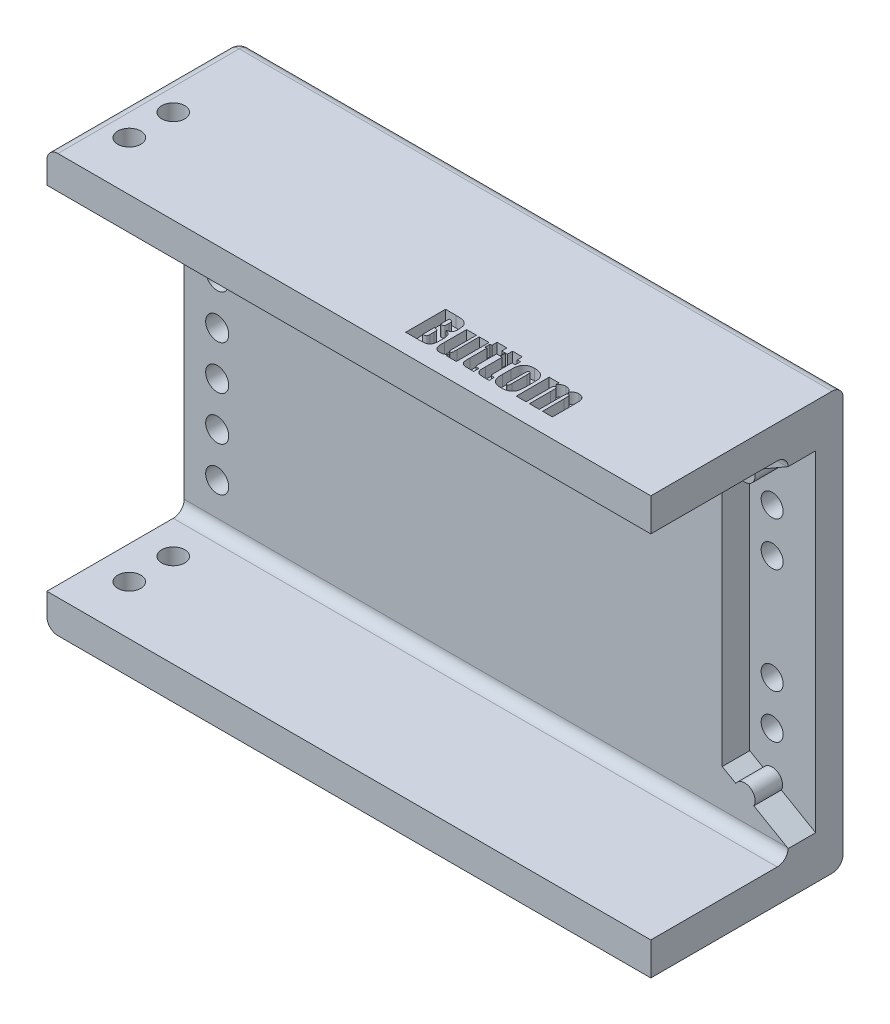
from build123d import *

# Parameters (mm, degrees)
SKETCH_2_W               = 109.92
SKETCH_2_H               = 76
EXTRUDE_1_DEPTH          = 10
CUT_EXTRUDE_1_DEPTH      = 5
SKETCH_4_R               = 2
CUT_EXTRUDE_2_DEPTH      = 92.808295873
SKETCH_5_W               = 109.92
SKETCH_5_H               = 6
EXTRUDE_2_DEPTH          = 25
CUT_EXTRUDE_3_DEPTH      = 104.340627651
CUT_EXTRUDE_3_DEPTH_BACK = 104.340627651
SKETCH_7_R               = 2.1
SKETCH_9_R               = 2.1
CUT_EXTRUDE_4_DEPTH      = 96.019804204
CUT_EXTRUDE_5_DEPTH      = 5
FILLET_1_R               = 2
CUT_EXTRUDE_6_DEPTH      = 2


with BuildPart() as part:
    # 草圖2 → 填料-伸長1 (new body)
    with BuildSketch(Plane.XY):
        with Locations((12.52544527, 24.044160626)):
            Rectangle(SKETCH_2_W, SKETCH_2_H)
    extrude(amount=EXTRUDE_1_DEPTH)

    # 草圖3 → 除料-伸長1 (cut)
    with BuildSketch(Plane.XY.offset(10)):
        with BuildLine():
            Line((67.48544527, -6.055839374), (67.48544527, 54.144160626))
            Line((67.48544527, 54.144160626), (61.24181631, 50.538464901))
            ThreePointArc((61.24181631, 50.538464901), (61.408690367, 50.105080914), (61.46544527, 49.644160626))
            ThreePointArc((61.46544527, 49.644160626), (60.088104264, 47.81746208), (57.95299519, 48.639170705))
            Line((57.95299519, 48.639170705), (55.48544527, 47.214160626))
            Line((55.48544527, 47.214160626), (55.48544527, 0.874160626))
            Line((55.48544527, 0.874160626), (57.95299519, -0.550849453))
            ThreePointArc((57.95299519, -0.550849453), (60.088104264, 0.270859171), (61.46544527, -1.555839374))
            ThreePointArc((61.46544527, -1.555839374), (61.408690367, -2.016759663), (61.24181631, -2.45014365))
            Line((61.24181631, -2.45014365), (67.48544527, -6.055839374))
        make_face()
    extrude(amount=-CUT_EXTRUDE_1_DEPTH, mode=Mode.SUBTRACT)

    # 草圖4 → 除料-伸長2 (cut, through all)
    with BuildSketch(Plane.XY.offset(5)):
        with Locations((59.56544527, 41.644160626)):
            Circle(SKETCH_4_R)
        with Locations((59.56544527, 33.644160626)):
            Circle(SKETCH_4_R)
        with Locations((59.56544527, 6.444160626)):
            Circle(SKETCH_4_R)
        with Locations((59.56544527, 14.444160626)):
            Circle(SKETCH_4_R)
    extrude(amount=-CUT_EXTRUDE_2_DEPTH, mode=Mode.SUBTRACT)

    # 草圖5 → 填料-伸長2 (add)
    with BuildSketch(Plane.XY.offset(10)):
        with Locations((12.52544527, -10.955839374)):
            Rectangle(SKETCH_5_W, SKETCH_5_H)
        with Locations((12.52544527, 59.044160626)):
            Rectangle(SKETCH_5_W, SKETCH_5_H)
    extrude(amount=EXTRUDE_2_DEPTH)

    # 草圖7 → 除料-伸長3 (cut, two sides: drawn at the far end of the back side and taken through both)
    with BuildSketch(Plane(origin=(0, -7.955839374, 0), x_dir=(1, 0, 0), z_dir=(0, 1, 0)).offset(-CUT_EXTRUDE_3_DEPTH_BACK)):
        with Locations(Location((-36.43455473, -18, 0), (0, 0, 270))):
            Circle(SKETCH_7_R)
        with Locations(Location((-36.43455473, -26, 0), (0, 0, 270))):
            Circle(SKETCH_7_R)
    extrude(amount=CUT_EXTRUDE_3_DEPTH + CUT_EXTRUDE_3_DEPTH_BACK, mode=Mode.SUBTRACT)

    # 草圖9 → 除料-伸長4 (cut, through all)
    with BuildSketch(Plane.XY.offset(10)):
        with Locations((-36.43455473, 0.044160626)):
            Circle(SKETCH_9_R)
        with Locations((-36.43455473, 8.044160626)):
            Circle(SKETCH_9_R)
        with Locations((-36.43455473, 16.044160626)):
            Circle(SKETCH_9_R)
        with Locations((-36.43455473, 24.044160626)):
            Circle(SKETCH_9_R)
        with Locations((-36.43455473, 32.044160626)):
            Circle(SKETCH_9_R)
        with Locations((-36.43455473, 40.044160626)):
            Circle(SKETCH_9_R)
        with Locations((-36.43455473, 48.044160626)):
            Circle(SKETCH_9_R)
    extrude(amount=-CUT_EXTRUDE_4_DEPTH, mode=Mode.SUBTRACT)

    # 草圖10 → 除料-伸長5 (cut)
    with BuildSketch(Plane(origin=(0, 0, 0), x_dir=(-1, 0, 0), z_dir=(0, 0, -1))):
        with BuildLine():
            Line((32.43455473, 0.044160626), (32.43455473, 48.044160626))
            ThreePointArc((32.43455473, 48.044160626), (36.43455473, 52.044160626), (40.43455473, 48.044160626))
            Line((40.43455473, 48.044160626), (40.43455473, 0.044160626))
            ThreePointArc((40.43455473, 0.044160626), (36.43455473, -3.955839374), (32.43455473, 0.044160626))
        make_face()
    extrude(amount=-CUT_EXTRUDE_5_DEPTH, mode=Mode.SUBTRACT)

    # 圓角1
    fillet_1_edges = [part.edges().sort_by_distance(p)[0] for p in [
        (12.52544527, 56.044160626, 10),
        (12.52544527, -7.955839374, 10),
        (-42.43455473, 62.044160626, 17.5),
        (-42.43455473, -13.955839374, 17.5),
        (-42.43455473, 24.044160626, 0),
        (12.52544527, -13.955839374, 0),
        (12.52544527, 62.044160626, 0),
    ]]
    fillet(fillet_1_edges, radius=FILLET_1_R - 0.0001)  # a hair under: the kernel refuses the full size

    # 草圖11 → 除料-伸長6 (cut)
    # profile 1 of 6: a face of its own
    with BuildSketch(Plane(origin=(0, 62.044160626, 62.044160626), x_dir=(-1, 0, 0), z_dir=(0, -1, 0))):
        with BuildLine():
            Line((-19.393974729, 37.772018325), (-21.317327272, 37.772018325))
            add(Edge.make_bspline(
                [(-21.317327272, 37.772018325), (-21.391082107, 37.771291446), (-21.533722337, 37.769885678), (-21.740849556, 37.76520881), (-21.934255834, 37.754908999), (-22.113670498, 37.738186673), (-22.279722046, 37.720668444), (-22.431714413, 37.696358362), (-22.570117507, 37.668818928), (-22.696402043, 37.63696519), (-22.812663003, 37.597684206), (-22.922409633, 37.551530111), (-23.025791597, 37.494942957), (-23.123050721, 37.429259749), (-23.215753475, 37.355746427), (-23.302183201, 37.273108102), (-23.382687668, 37.181550935), (-23.458078877, 37.081008177), (-23.527295896, 36.96808395), (-23.58559776, 36.838989186), (-23.634175607, 36.694065718), (-23.676033737, 36.533944129), (-23.705262316, 36.35759485), (-23.727817023, 36.165906343), (-23.743153064, 35.958207901), (-23.744047136, 35.814039634), (-23.744510211, 35.739369241)],
                knots=[0, 0, 0, 0, 1.41969272, 2.745654521, 3.987543411, 5.14658096, 6.21373459, 7.200711201, 8.108042895, 8.929411192, 9.70554979, 10.467999137, 11.218070552, 11.969943563, 12.724535131, 13.49271798, 14.268243868, 15.068689038, 15.909069341, 16.81215954, 17.78844528, 18.848344307, 19.994182421, 21.225693104, 22.563077773, 24, 24, 24, 24], degree=3))
            add(Edge.make_bspline(
                [(-23.744510211, 35.739369241), (-23.744298774, 35.689138971), (-23.743892194, 35.592549762), (-23.732485177, 35.453801347), (-23.716762707, 35.327017964), (-23.696380206, 35.211241149), (-23.667014075, 35.107954587), (-23.632431342, 35.01573961), (-23.591487065, 34.935219727), (-23.542309848, 34.865005878), (-23.48299394, 34.80356881), (-23.412357109, 34.7473094), (-23.330331362, 34.694315337), (-23.234873623, 34.646764175), (-23.128898108, 34.599161223), (-23.008577967, 34.559706048), (-22.877426024, 34.519790218), (-22.784991784, 34.498749276), (-22.73684942, 34.487790559)],
                knots=[0, 0, 0, 0, 1.327920484, 2.553495959, 3.678584238, 4.706394844, 5.65862556, 6.514014339, 7.30753027, 8.04101456, 8.772331145, 9.55771541, 10.424646689, 11.349518022, 12.375513716, 13.493956262, 14.694781581, 16, 16, 16, 16], degree=3))
            add(Edge.make_bspline(
                [(-22.73684942, 34.487790559), (-22.788142406, 34.475177999), (-22.887202813, 34.450819789), (-23.027910977, 34.40377848), (-23.155715527, 34.350692097), (-23.271362248, 34.292462231), (-23.373598562, 34.226681038), (-23.463058606, 34.15485586), (-23.540469343, 34.077241937), (-23.603846134, 33.991255393), (-23.65801928, 33.89723782), (-23.704838385, 33.792866113), (-23.742647543, 33.676424308), (-23.774858633, 33.548656777), (-23.799813466, 33.409716328), (-23.816714734, 33.258765122), (-23.827405595, 33.096856908), (-23.828995425, 32.984758548), (-23.829814829, 32.92698264)],
                knots=[0, 0, 0, 0, 1.193541528, 2.305046348, 3.349469872, 4.319601517, 5.227715379, 6.091898615, 6.908561027, 7.697906746, 8.498857849, 9.357421084, 10.27838222, 11.262396817, 12.333987418, 13.466302598, 14.694123014, 16, 16, 16, 16], degree=3))
            Line((-23.829814829, 32.92698264), (-23.829814829, 32.245878586))
            add(Edge.make_bspline(
                [(-23.829814829, 32.245878586), (-23.829339253, 32.185889265), (-23.828419353, 32.069852617), (-23.820365532, 31.901796163), (-23.807318793, 31.745701444), (-23.788881916, 31.601558613), (-23.765156022, 31.469346172), (-23.73607865, 31.349067436), (-23.701742139, 31.240625298), (-23.649454041, 31.114539958), (-23.568964697, 30.975424791), (-23.443160051, 30.836292146), (-23.292688661, 30.724961573), (-23.144742801, 30.657171827), (-23.006295146, 30.617948586), (-22.876632887, 30.591622952), (-22.723114246, 30.569465091), (-22.544641712, 30.553199342), (-22.342926541, 30.538424074), (-22.116274793, 30.527628023), (-21.865603419, 30.523292117), (-21.690091164, 30.521868326), (-21.598565933, 30.521125855)],
                knots=[0, 0, 0, 0, 1.057231904, 2.044991421, 2.964498811, 3.817267374, 4.605195048, 5.330688826, 5.996832831, 6.607610909, 7.734358025, 8.809960447, 9.890596186, 11.011751471, 11.656044114, 12.423911222, 13.341950389, 14.388368498, 15.581715371, 16.906549738, 18.386843414, 20, 20, 20, 20], degree=3))
            Line((-21.598565933, 30.521125855), (-19.393974729, 30.521125855))
            Line((-19.393974729, 30.521125855), (-19.393974729, 37.772018325))
        make_face()
        with BuildLine():
            Line((-21.27067631, 36.577753683), (-21.27067631, 34.956965954))
            add(Edge.make_bspline(
                [(-21.27067631, 34.956965954), (-21.310216963, 34.957939648), (-21.379519977, 34.959646243), (-21.448837656, 34.96056853), (-21.478606314, 34.960964608)],
                knots=[0, 0, 0, 0, 1.141094767, 2, 2, 2, 2], degree=3))
            add(Edge.make_bspline(
                [(-21.478606314, 34.960964608), (-21.525448616, 34.961805921), (-21.610316423, 34.963330193), (-21.724073084, 34.990048835), (-21.812813549, 35.031243879), (-21.866209127, 35.086499938), (-21.891914013, 35.144928952), (-21.908737993, 35.203612966), (-21.921023439, 35.278396147), (-21.933203569, 35.368567964), (-21.942047371, 35.475340107), (-21.948501347, 35.597570968), (-21.952471209, 35.735789372), (-21.952890956, 35.833112759), (-21.953113248, 35.884653667)],
                knots=[0, 0, 0, 0, 1.37184632, 2.485479705, 3.407178563, 4.210095408, 4.671083265, 5.269542147, 5.998719677, 6.893441603, 7.940942625, 9.142754617, 10.486848569, 12, 12, 12, 12], degree=3))
            add(Edge.make_bspline(
                [(-21.953113248, 35.884653667), (-21.952645566, 35.937569417), (-21.951783039, 36.035159772), (-21.938490737, 36.168391672), (-21.919238855, 36.276885359), (-21.887987814, 36.361327537), (-21.849618047, 36.426225497), (-21.806297961, 36.476807237), (-21.757890301, 36.515649465), (-21.699516261, 36.541043569), (-21.626303772, 36.556394632), (-21.531323425, 36.567535946), (-21.409846863, 36.57508598), (-21.32000483, 36.576808125), (-21.27067631, 36.577753683)],
                knots=[0, 0, 0, 0, 1.612962093, 2.974720053, 4.080187332, 4.963539136, 5.704836737, 6.3676796, 6.985654596, 7.580003915, 8.289925548, 9.259673838, 10.495400982, 12, 12, 12, 12], degree=3))
        make_face(mode=Mode.SUBTRACT)
        with BuildLine():
            Line((-21.27067631, 33.848005929), (-21.27067631, 31.715390497))
            add(Edge.make_bspline(
                [(-21.27067631, 31.715390497), (-21.305784755, 31.71696004), (-21.372518315, 31.719943402), (-21.467795462, 31.727427119), (-21.552679761, 31.739626624), (-21.628175384, 31.753615446), (-21.693584402, 31.772436202), (-21.749599849, 31.793241373), (-21.796129167, 31.816734202), (-21.833085692, 31.846126078), (-21.862201865, 31.883374845), (-21.887805801, 31.928896027), (-21.906867241, 31.986556205), (-21.924034339, 32.053753673), (-21.93720521, 32.131782701), (-21.945793111, 32.22041393), (-21.953216897, 32.319511963), (-21.953148786, 32.389369344), (-21.953113248, 32.425818013)],
                knots=[0, 0, 0, 0, 1.419095288, 2.697393149, 3.856866357, 4.880718774, 5.794967692, 6.601281627, 7.291456808, 7.891047755, 8.490638702, 9.189387817, 9.989490768, 10.933700266, 11.989587216, 13.180284702, 14.528790147, 16, 16, 16, 16], degree=3))
            Line((-21.953113248, 32.425818013), (-21.953113248, 33.137578413))
            add(Edge.make_bspline(
                [(-21.953113248, 33.137578413), (-21.952951506, 33.17623285), (-21.952644571, 33.249586235), (-21.947873937, 33.353739918), (-21.937321801, 33.445958227), (-21.929070754, 33.526695502), (-21.91183169, 33.59449254), (-21.894446921, 33.651039125), (-21.871830627, 33.695568944), (-21.845493961, 33.730737403), (-21.809593923, 33.75593076), (-21.765874066, 33.778438951), (-21.709924576, 33.796500544), (-21.643470933, 33.812102831), (-21.565978772, 33.82517452), (-21.477462018, 33.835678897), (-21.377856592, 33.843536837), (-21.307565694, 33.846467754), (-21.27067631, 33.848005929)],
                knots=[0, 0, 0, 0, 1.538310229, 2.919206019, 4.145426389, 5.233175983, 6.142307499, 6.925059207, 7.5813867, 8.122596664, 8.653013429, 9.309340922, 10.075339784, 10.9844713, 12.025073956, 13.200531974, 14.530810454, 16, 16, 16, 16], degree=3))
        make_face(mode=Mode.SUBTRACT)
    # profile 2 of 6: a face of its own
    with BuildSketch(Plane(origin=(0, 62.044160626, 62.044160626), x_dir=(-1, 0, 0), z_dir=(0, -1, 0))):
        with BuildLine():
            Line((-28.606873397, 36.492449065), (-28.606873397, 30.521125855))
            Line((-28.606873397, 30.521125855), (-26.786152971, 30.521125855))
            Line((-26.786152971, 30.521125855), (-26.815476434, 31.031620674))
            add(Edge.make_bspline(
                [(-26.815476434, 31.031620674), (-26.784283308, 30.984034821), (-26.723555747, 30.891393484), (-26.613351517, 30.770615454), (-26.494592074, 30.666628451), (-26.364215451, 30.582282669), (-26.224018865, 30.515960887), (-26.073245132, 30.469498142), (-25.912423262, 30.440876792), (-25.801716789, 30.437530473), (-25.745170064, 30.435821238)],
                knots=[0, 0, 0, 0, 1.061666706, 2.066879479, 3.043894156, 4.004116477, 4.958543322, 5.932696836, 6.944061519, 8, 8, 8, 8], degree=3))
            add(Edge.make_bspline(
                [(-25.745170064, 30.435821238), (-25.681524051, 30.437523414), (-25.559407308, 30.440789357), (-25.384607774, 30.467996252), (-25.225689556, 30.510601353), (-25.085053438, 30.574299361), (-24.960769921, 30.651014302), (-24.856956572, 30.74395915), (-24.764563635, 30.843391532), (-24.695606653, 30.958304974), (-24.639602703, 31.078504071), (-24.596485236, 31.202129183), (-24.56196964, 31.327456954), (-24.543796972, 31.436327107), (-24.535706332, 31.533186702), (-24.528805855, 31.621565549), (-24.523665159, 31.726014422), (-24.52015832, 31.846009896), (-24.515714614, 31.981943787), (-24.513318259, 32.133908226), (-24.511943219, 32.301857032), (-24.512145848, 32.419153265), (-24.512251767, 32.480466283)],
                knots=[0, 0, 0, 0, 1.372356562, 2.633121929, 3.807600132, 4.910298633, 5.952776581, 6.944670893, 7.908661259, 8.868831557, 9.820833315, 10.766735229, 11.689826756, 12.622720248, 13.142547126, 13.786556214, 14.535201573, 15.398368654, 16.376504451, 17.469410664, 18.677211821, 20, 20, 20, 20], degree=3))
            Line((-24.512251767, 32.480466283), (-24.512251767, 36.492449065))
            Line((-24.512251767, 36.492449065), (-26.30364873, 36.492449065))
            Line((-26.30364873, 36.492449065), (-26.30364873, 32.420486474))
            add(Edge.make_bspline(
                [(-26.30364873, 32.420486474), (-26.303361098, 32.364946897), (-26.302818006, 32.260080169), (-26.306403285, 32.111702479), (-26.308414249, 31.981496395), (-26.312407362, 31.869072899), (-26.317494775, 31.774390048), (-26.32393137, 31.697032857), (-26.33128417, 31.637255704), (-26.342515223, 31.582874173), (-26.365871162, 31.530824465), (-26.415908359, 31.488503616), (-26.481274633, 31.462559533), (-26.530407618, 31.460556529), (-26.556896813, 31.459476645)],
                knots=[0, 0, 0, 0, 1.812042913, 3.421398194, 4.842335651, 6.06080483, 7.091677302, 7.935583642, 8.593692084, 9.054393081, 9.748100288, 10.405409957, 11.140304508, 12, 12, 12, 12], degree=3))
            add(Edge.make_bspline(
                [(-26.556896813, 31.459476645), (-26.58511488, 31.460543939), (-26.636766484, 31.462497561), (-26.706340968, 31.487895928), (-26.756939681, 31.533003752), (-26.780138545, 31.587322577), (-26.788299593, 31.643731237), (-26.797312979, 31.705795196), (-26.800880599, 31.786936791), (-26.806955615, 31.886379561), (-26.810633295, 32.004608722), (-26.812752017, 32.141467579), (-26.816293522, 32.297402568), (-26.815758844, 32.407599631), (-26.815476434, 32.465804552)],
                knots=[0, 0, 0, 0, 0.876067957, 1.603593713, 2.260088472, 2.929160625, 3.393475713, 4.035657034, 4.88190587, 5.921621531, 7.140530935, 8.566649448, 10.186540624, 12, 12, 12, 12], degree=3))
            Line((-26.815476434, 32.465804552), (-26.815476434, 36.492449065))
            Line((-26.815476434, 36.492449065), (-28.606873397, 36.492449065))
        make_face()
    # profile 3 of 6: a face of its own
    with BuildSketch(Plane(origin=(0, 62.044160626, 62.044160626), x_dir=(-1, 0, 0), z_dir=(0, -1, 0))):
        with BuildLine():
            Line((-31.080707298, 37.260190621), (-31.080707298, 36.321839831))
            Line((-31.080707298, 36.321839831), (-31.677839619, 36.321839831))
            Line((-31.677839619, 36.321839831), (-31.677839619, 35.383489041))
            Line((-31.677839619, 35.383489041), (-31.080707298, 35.383489041))
            Line((-31.080707298, 35.383489041), (-31.080707298, 32.184565892))
            add(Edge.make_bspline(
                [(-31.080707298, 32.184565892), (-31.081119326, 32.137916735), (-31.081892437, 32.050386228), (-31.083459537, 31.927218942), (-31.090584491, 31.820579021), (-31.098706349, 31.729968475), (-31.106269807, 31.655213021), (-31.120163482, 31.597410081), (-31.133315532, 31.554981111), (-31.152025747, 31.524378244), (-31.182738543, 31.507227091), (-31.223451366, 31.494778549), (-31.278626582, 31.48490914), (-31.347563939, 31.475902539), (-31.431109172, 31.467685023), (-31.528946741, 31.462802698), (-31.641396172, 31.460497223), (-31.720935266, 31.459830471), (-31.763144236, 31.459476645)],
                knots=[0, 0, 0, 0, 1.739732428, 3.26436042, 4.592396978, 5.723406921, 6.6584426, 7.389883741, 7.934871935, 8.316298907, 8.688621296, 9.212551535, 9.90465525, 10.773969042, 11.805991926, 13.033823307, 14.425940557, 16, 16, 16, 16], degree=3))
            Line((-31.763144236, 31.459476645), (-31.763144236, 30.521125855))
            Line((-31.763144236, 30.521125855), (-31.003399989, 30.521125855))
            add(Edge.make_bspline(
                [(-31.003399989, 30.521125855), (-30.951862201, 30.521617558), (-30.852340681, 30.522567056), (-30.708809022, 30.523171543), (-30.576797438, 30.526910135), (-30.456463926, 30.534342725), (-30.347554217, 30.540512575), (-30.249670261, 30.548009784), (-30.163502121, 30.558906677), (-30.064388699, 30.573946829), (-29.951737932, 30.603563368), (-29.825050627, 30.65369395), (-29.708176703, 30.723661905), (-29.599408243, 30.805912103), (-29.506231155, 30.902183228), (-29.429465812, 31.00628301), (-29.373189207, 31.117508609), (-29.341192641, 31.218882506), (-29.32667681, 31.312181891), (-29.315696179, 31.402367634), (-29.308557426, 31.513176776), (-29.302382778, 31.644287171), (-29.29500795, 31.795298952), (-29.29133078, 31.966399152), (-29.290740969, 32.157908776), (-29.289802695, 32.292529842), (-29.289310335, 32.363172435)],
                knots=[0, 0, 0, 0, 1.195583195, 2.308718731, 3.329517598, 4.258521121, 5.105212991, 5.860114927, 6.535083728, 7.11964657, 8.184549345, 9.22951552, 10.268875888, 11.334626177, 12.384156653, 13.365429045, 14.324142953, 15.262984696, 15.817041888, 16.512473617, 17.370134424, 18.391765408, 19.557524602, 20.877102082, 22.361254963, 24, 24, 24, 24], degree=3))
            Line((-29.289310335, 32.363172435), (-29.289310335, 35.383489041))
            Line((-29.289310335, 35.383489041), (-28.948091866, 35.383489041))
            Line((-28.948091866, 35.383489041), (-28.948091866, 36.321839831))
            Line((-28.948091866, 36.321839831), (-29.289310335, 36.321839831))
            Line((-29.289310335, 36.321839831), (-29.289310335, 37.260190621))
            Line((-29.289310335, 37.260190621), (-31.080707298, 37.260190621))
        make_face()
    # profile 4 of 6: a face of its own
    with BuildSketch(Plane(origin=(0, 62.044160626, 62.044160626), x_dir=(-1, 0, 0), z_dir=(0, -1, 0))):
        with BuildLine():
            Line((-33.895759669, 37.260190621), (-33.895759669, 36.321839831))
            Line((-33.895759669, 36.321839831), (-34.49289199, 36.321839831))
            Line((-34.49289199, 36.321839831), (-34.49289199, 35.383489041))
            Line((-34.49289199, 35.383489041), (-33.895759669, 35.383489041))
            Line((-33.895759669, 35.383489041), (-33.895759669, 32.184565892))
            add(Edge.make_bspline(
                [(-33.895759669, 32.184565892), (-33.896171696, 32.137916735), (-33.896944807, 32.050386228), (-33.898511907, 31.927218942), (-33.905636861, 31.820579021), (-33.91375872, 31.729968475), (-33.921322178, 31.655213021), (-33.935215853, 31.597410081), (-33.948367902, 31.554981111), (-33.967078118, 31.524378244), (-33.997790914, 31.507227091), (-34.038503737, 31.494778549), (-34.093678952, 31.48490914), (-34.162616309, 31.475902539), (-34.246161542, 31.467685023), (-34.343999111, 31.462802698), (-34.456448542, 31.460497223), (-34.535987637, 31.459830471), (-34.578196607, 31.459476645)],
                knots=[0, 0, 0, 0, 1.739732428, 3.26436042, 4.592396978, 5.723406921, 6.6584426, 7.389883741, 7.934871935, 8.316298907, 8.688621296, 9.212551535, 9.90465525, 10.773969042, 11.805991926, 13.033823307, 14.425940557, 16, 16, 16, 16], degree=3))
            Line((-34.578196607, 31.459476645), (-34.578196607, 30.521125855))
            Line((-34.578196607, 30.521125855), (-33.818452359, 30.521125855))
            add(Edge.make_bspline(
                [(-33.818452359, 30.521125855), (-33.766914571, 30.521617558), (-33.667393051, 30.522567056), (-33.523861393, 30.523171543), (-33.391849808, 30.526910135), (-33.271516296, 30.534342725), (-33.162606587, 30.540512575), (-33.064722631, 30.548009784), (-32.978554491, 30.558906677), (-32.879441069, 30.573946829), (-32.766790302, 30.603563368), (-32.640102998, 30.65369395), (-32.523229073, 30.723661905), (-32.414460614, 30.805912103), (-32.321283525, 30.902183228), (-32.244518182, 31.00628301), (-32.188241578, 31.117508609), (-32.156245012, 31.218882506), (-32.14172918, 31.312181891), (-32.130748549, 31.402367634), (-32.123609796, 31.513176776), (-32.117435149, 31.644287171), (-32.11006032, 31.795298952), (-32.106383151, 31.966399152), (-32.10579334, 32.157908776), (-32.104855066, 32.292529842), (-32.104362706, 32.363172435)],
                knots=[0, 0, 0, 0, 1.195583195, 2.308718731, 3.329517598, 4.258521121, 5.105212991, 5.860114927, 6.535083728, 7.11964657, 8.184549345, 9.22951552, 10.268875888, 11.334626177, 12.384156653, 13.365429045, 14.324142953, 15.262984696, 15.817041888, 16.512473617, 17.370134424, 18.391765408, 19.557524602, 20.877102082, 22.361254963, 24, 24, 24, 24], degree=3))
            Line((-32.104362706, 32.363172435), (-32.104362706, 35.383489041))
            Line((-32.104362706, 35.383489041), (-31.763144236, 35.383489041))
            Line((-31.763144236, 35.383489041), (-31.763144236, 36.321839831))
            Line((-31.763144236, 36.321839831), (-32.104362706, 36.321839831))
            Line((-32.104362706, 36.321839831), (-32.104362706, 37.260190621))
            Line((-32.104362706, 37.260190621), (-33.895759669, 37.260190621))
        make_face()
    # profile 5 of 6: a face of its own
    with BuildSketch(Plane(origin=(0, 62.044160626, 62.044160626), x_dir=(-1, 0, 0), z_dir=(0, -1, 0))):
        with BuildLine():
            Line((-38.928732089, 34.389157095), (-38.928732089, 32.937645717))
            add(Edge.make_bspline(
                [(-38.928732089, 32.937645717), (-38.928550918, 32.873218486), (-38.928201032, 32.748793899), (-38.923435936, 32.568873888), (-38.919459615, 32.402141484), (-38.908969897, 32.24894722), (-38.899739462, 32.108750874), (-38.884187839, 31.9822535), (-38.868967252, 31.868727563), (-38.844331666, 31.735294273), (-38.801767947, 31.579177196), (-38.728050916, 31.40016056), (-38.628801047, 31.229225097), (-38.511479413, 31.064262372), (-38.373002655, 30.912241071), (-38.211989792, 30.782549225), (-38.034475979, 30.671454225), (-37.837571674, 30.584249077), (-37.623919988, 30.518005637), (-37.395367725, 30.470694247), (-37.151917021, 30.440435778), (-36.984590473, 30.437385889), (-36.898748774, 30.435821238)],
                knots=[0, 0, 0, 0, 1.030820639, 1.990764312, 2.879836517, 3.698877591, 4.447479564, 5.127340947, 5.737592725, 6.27997261, 7.297519797, 8.320663796, 9.368189507, 10.453252059, 11.55504584, 12.646447391, 13.751149947, 14.896660089, 16.081551939, 17.323827552, 18.627072679, 20, 20, 20, 20], degree=3))
            add(Edge.make_bspline(
                [(-36.898748774, 30.435821238), (-36.803605077, 30.437082752), (-36.620946335, 30.439504632), (-36.358145528, 30.465430035), (-36.117835688, 30.505948519), (-35.89934414, 30.561931503), (-35.704276382, 30.637382181), (-35.530532996, 30.726931415), (-35.380786853, 30.836122933), (-35.253458564, 30.961760466), (-35.147848663, 31.104034996), (-35.058233198, 31.259394159), (-34.985015179, 31.428532119), (-34.93669254, 31.579977834), (-34.907322884, 31.712255573), (-34.886996178, 31.824220077), (-34.872197977, 31.948532448), (-34.856792226, 32.083906677), (-34.846282488, 32.231532485), (-34.840720017, 32.390698217), (-34.834288234, 32.561724672), (-34.834171035, 32.679503123), (-34.834110459, 32.740378789)],
                knots=[0, 0, 0, 0, 1.566851768, 3.008072865, 4.344862402, 5.578649608, 6.716279408, 7.783554075, 8.789251884, 9.757031178, 10.718730646, 11.699157592, 12.705361265, 13.749293612, 14.312132592, 14.936642054, 15.622938965, 16.373791341, 17.180992382, 18.06001777, 18.997289313, 20, 20, 20, 20], degree=3))
            Line((-34.834110459, 32.740378789), (-34.834110459, 34.259867285))
            add(Edge.make_bspline(
                [(-34.834110459, 34.259867285), (-34.834639185, 34.326960014), (-34.835665523, 34.457197328), (-34.843096395, 34.647099622), (-34.858593392, 34.825210906), (-34.87595147, 34.992662826), (-34.902119291, 35.148044032), (-34.930368191, 35.29304049), (-34.966594795, 35.425987094), (-35.007669487, 35.549386513), (-35.057966074, 35.663561815), (-35.114563999, 35.772249616), (-35.182756105, 35.873617324), (-35.256037649, 35.9715652), (-35.341986455, 36.061073872), (-35.434488472, 36.146383424), (-35.536878443, 36.22530882), (-35.646957766, 36.298575658), (-35.766346895, 36.364350863), (-35.894205712, 36.420802494), (-36.029027254, 36.47122785), (-36.173032891, 36.509121312), (-36.324403873, 36.539489608), (-36.484087471, 36.562455406), (-36.65148847, 36.575799707), (-36.765880642, 36.577094581), (-36.824107234, 36.577753683)],
                knots=[0, 0, 0, 0, 1.367165939, 2.653879496, 3.871100312, 5.009836591, 6.082946868, 7.080781523, 8.018528806, 8.888869268, 9.728143456, 10.558384481, 11.381984661, 12.214936081, 13.047543032, 13.906222177, 14.777268644, 15.678695825, 16.598484629, 17.550802427, 18.52460938, 19.528259021, 20.581129208, 21.669407874, 22.813708716, 24, 24, 24, 24], degree=3))
            add(Edge.make_bspline(
                [(-36.824107234, 36.577753683), (-36.921098125, 36.576173277), (-37.108200797, 36.573124558), (-37.377899949, 36.536671687), (-37.627175237, 36.48322141), (-37.853168201, 36.40152562), (-38.056973104, 36.305285383), (-38.237227833, 36.194052228), (-38.394315809, 36.070349086), (-38.523413709, 35.930089163), (-38.63040591, 35.783256286), (-38.721550893, 35.634514972), (-38.792013501, 35.482280394), (-38.837018066, 35.351343908), (-38.863507762, 35.240908838), (-38.880148416, 35.148663213), (-38.897022367, 35.047105819), (-38.908148263, 34.934888121), (-38.917508184, 34.812677648), (-38.924015144, 34.680227512), (-38.928026806, 34.538021282), (-38.928492109, 34.439809621), (-38.928732089, 34.389157095)],
                knots=[0, 0, 0, 0, 1.658815711, 3.199979415, 4.649957207, 6.01364259, 7.3027161, 8.501301308, 9.631864061, 10.713282271, 11.752046223, 12.737947139, 13.693922422, 14.617315316, 15.102372854, 15.636288777, 16.22136206, 16.863764619, 17.565366476, 18.319134645, 19.133096068, 20, 20, 20, 20], degree=3))
        make_face()
        with BuildLine():
            add(Edge.make_bspline(
                [(-37.137335126, 34.853000952), (-37.136829401, 34.889875631), (-37.135872782, 34.959627147), (-37.135448607, 35.05920014), (-37.131140425, 35.14761987), (-37.125965884, 35.225857841), (-37.119428144, 35.292974051), (-37.112120997, 35.350162409), (-37.101229823, 35.395779881), (-37.088359068, 35.442328263), (-37.061375402, 35.487454665), (-37.015823702, 35.529204802), (-36.953474877, 35.549418638), (-36.909068456, 35.55247214), (-36.885419928, 35.554098275)],
                knots=[0, 0, 0, 0, 1.585193112, 2.998524278, 4.279327145, 5.389603052, 6.36823621, 7.178467141, 7.864111684, 8.383615122, 9.248283339, 10.08726259, 10.981376477, 12, 12, 12, 12], degree=3))
            add(Edge.make_bspline(
                [(-36.885419928, 35.554098275), (-36.861250742, 35.552645408), (-36.816672171, 35.549965684), (-36.75450384, 35.528077226), (-36.706740228, 35.488205104), (-36.679119327, 35.442224759), (-36.66372965, 35.396090571), (-36.653961998, 35.349975318), (-36.644010726, 35.293160856), (-36.638841133, 35.225754031), (-36.631059138, 35.147710912), (-36.627596301, 35.059182338), (-36.626909617, 34.959632438), (-36.625992345, 34.889877461), (-36.625507422, 34.853000952)],
                knots=[0, 0, 0, 0, 1.033270833, 1.905804199, 2.770216926, 3.641090693, 4.164334303, 4.847116915, 5.656874259, 6.631422529, 7.738535089, 9.013991789, 10.421423604, 12, 12, 12, 12], degree=3))
            Line((-36.625507422, 34.853000952), (-36.625507422, 32.143246468))
            add(Edge.make_bspline(
                [(-36.625507422, 32.143246468), (-36.625577728, 32.078354651), (-36.625704981, 31.960900559), (-36.636711912, 31.802981802), (-36.650571924, 31.68183741), (-36.671769699, 31.592989533), (-36.705682407, 31.53018352), (-36.753485219, 31.488303967), (-36.813906227, 31.463196315), (-36.858064049, 31.460763487), (-36.881421274, 31.459476645)],
                knots=[0, 0, 0, 0, 1.905444241, 3.448851208, 4.646660283, 5.485608871, 6.116872217, 6.708589425, 7.316910003, 8, 8, 8, 8], degree=3))
            add(Edge.make_bspline(
                [(-36.881421274, 31.459476645), (-36.905598399, 31.460925987), (-36.950191613, 31.463599209), (-37.011663534, 31.485318547), (-37.058957306, 31.523941135), (-37.092170871, 31.581902472), (-37.113521589, 31.663069015), (-37.12775547, 31.77357799), (-37.136576448, 31.91740886), (-37.137064762, 32.024161338), (-37.137335126, 32.083266659)],
                knots=[0, 0, 0, 0, 0.759541473, 1.400927311, 2.016662793, 2.637613118, 3.469132219, 4.641499325, 6.140509111, 8, 8, 8, 8], degree=3))
            Line((-37.137335126, 32.083266659), (-37.137335126, 34.853000952))
        make_face(mode=Mode.SUBTRACT)
    # profile 6 of 6: a face of its own
    with BuildSketch(Plane(origin=(0, 62.044160626, 62.044160626), x_dir=(-1, 0, 0), z_dir=(0, -1, 0))):
        with BuildLine():
            Line((-41.317261373, 36.492449065), (-41.317261373, 35.91131136))
            add(Edge.make_bspline(
                [(-41.317261373, 35.91131136), (-41.353295013, 35.964294794), (-41.423861556, 36.068054997), (-41.548929933, 36.203185215), (-41.681527152, 36.320783735), (-41.826983239, 36.413827857), (-41.981453146, 36.488617881), (-42.147135519, 36.540489068), (-42.322862899, 36.571578943), (-42.443420796, 36.575669157), (-42.504861592, 36.577753683)],
                knots=[0, 0, 0, 0, 1.077223304, 2.1095822, 3.090370703, 4.052939172, 5.006340392, 5.971404446, 6.966152131, 8, 8, 8, 8], degree=3))
            add(Edge.make_bspline(
                [(-42.504861592, 36.577753683), (-42.564970286, 36.575666224), (-42.68288228, 36.57157137), (-42.854681246, 36.540540334), (-43.016670992, 36.48828622), (-43.168217881, 36.413877459), (-43.31100153, 36.320253895), (-43.44222272, 36.203611358), (-43.56445718, 36.067496484), (-43.63412741, 35.964203567), (-43.669802772, 35.91131136)],
                knots=[0, 0, 0, 0, 1.025789608, 2.012236342, 2.969316882, 3.922572519, 4.886093681, 5.875074288, 6.911909806, 8, 8, 8, 8], degree=3))
            add(Edge.make_bspline(
                [(-43.669802772, 35.91131136), (-43.708806726, 35.964081077), (-43.784641824, 36.066680845), (-43.911822516, 36.203649095), (-44.046863019, 36.319181453), (-44.189672886, 36.413638579), (-44.340222042, 36.488333857), (-44.499678095, 36.539942729), (-44.666883861, 36.571589272), (-44.780844254, 36.575676924), (-44.838742605, 36.577753683)],
                knots=[0, 0, 0, 0, 1.121403297, 2.180336103, 3.188108587, 4.153139269, 5.101063311, 6.052421157, 7.010519338, 8, 8, 8, 8], degree=3))
            add(Edge.make_bspline(
                [(-44.838742605, 36.577753683), (-44.913618164, 36.575629561), (-45.058471901, 36.571520251), (-45.264709738, 36.527807921), (-45.452028544, 36.458698317), (-45.615261888, 36.359262815), (-45.754855396, 36.241144203), (-45.869744801, 36.109195116), (-45.954634242, 35.962822991), (-46.003709317, 35.829795189), (-46.029150643, 35.713164076), (-46.046044394, 35.612538522), (-46.062570775, 35.499793337), (-46.073814011, 35.373843838), (-46.083128994, 35.235634706), (-46.089622799, 35.084529303), (-46.093622313, 34.921000145), (-46.094082011, 34.807685395), (-46.094319941, 34.749035949)],
                knots=[0, 0, 0, 0, 1.396274718, 2.701223389, 3.916961255, 5.107873857, 6.249837686, 7.3206937, 8.358018463, 9.39218657, 9.953717558, 10.585231331, 11.297424592, 12.080859583, 12.945645179, 13.884064098, 14.904833943, 16, 16, 16, 16], degree=3))
            Line((-46.094319941, 34.749035949), (-46.094319941, 30.521125855))
            Line((-46.094319941, 30.521125855), (-44.302922978, 30.521125855))
            Line((-44.302922978, 30.521125855), (-44.302922978, 34.422479211))
            add(Edge.make_bspline(
                [(-44.302922978, 34.422479211), (-44.302434724, 34.483347549), (-44.301508107, 34.598864453), (-44.300865335, 34.763271552), (-44.297324384, 34.909510663), (-44.289725237, 35.037384368), (-44.284353815, 35.146866237), (-44.274700811, 35.237939638), (-44.264717649, 35.311032868), (-44.249994216, 35.381718716), (-44.223633544, 35.451336791), (-44.169211089, 35.51253141), (-44.094945357, 35.548241684), (-44.040308442, 35.552054486), (-44.011021241, 35.554098275)],
                knots=[0, 0, 0, 0, 1.713054107, 3.251061448, 4.626981132, 5.828964419, 6.856173046, 7.710918569, 8.405859511, 8.930717602, 9.743458848, 10.46932057, 11.179504966, 12, 12, 12, 12], degree=3))
            add(Edge.make_bspline(
                [(-44.011021241, 35.554098275), (-43.981213019, 35.552703708), (-43.924936481, 35.55007083), (-43.849951488, 35.512312278), (-43.791333314, 35.453228801), (-43.763139154, 35.383204995), (-43.746279314, 35.313007438), (-43.736982127, 35.23961735), (-43.725159388, 35.148756404), (-43.720528931, 35.038694031), (-43.712567268, 34.910852268), (-43.709621234, 34.764591485), (-43.706671502, 34.599765606), (-43.7060953, 34.483794308), (-43.705790657, 34.422479211)],
                knots=[0, 0, 0, 0, 0.826216397, 1.559858194, 2.289277558, 3.106944553, 3.631407287, 4.309815047, 5.173054605, 6.193999705, 7.388653756, 8.756183606, 10.284964305, 12, 12, 12, 12], degree=3))
            Line((-43.705790657, 34.422479211), (-43.705790657, 30.521125855))
            Line((-43.705790657, 30.521125855), (-41.914393694, 30.521125855))
            Line((-41.914393694, 30.521125855), (-41.914393694, 34.322512863))
            add(Edge.make_bspline(
                [(-41.914393694, 34.322512863), (-41.913866063, 34.392265693), (-41.912867929, 34.524218822), (-41.912721285, 34.711300687), (-41.907654285, 34.876104253), (-41.904740469, 35.019232715), (-41.898196359, 35.140140728), (-41.889596837, 35.239106213), (-41.88324968, 35.316426556), (-41.869796354, 35.387286939), (-41.846076714, 35.455795833), (-41.791319362, 35.514490222), (-41.717120109, 35.549814873), (-41.661564951, 35.552604683), (-41.631822149, 35.554098275)],
                knots=[0, 0, 0, 0, 1.818527428, 3.440152716, 4.876833041, 6.116673496, 7.172292882, 8.032228621, 8.707612752, 9.19146093, 9.91415351, 10.561648488, 11.229943611, 12, 12, 12, 12], degree=3))
            add(Edge.make_bspline(
                [(-41.631822149, 35.554098275), (-41.612130363, 35.553223394), (-41.573268183, 35.551496796), (-41.517344611, 35.533048748), (-41.465634434, 35.503502129), (-41.421723409, 35.46147113), (-41.381732349, 35.414304925), (-41.35491107, 35.3583637), (-41.333324798, 35.299231181), (-41.324979079, 35.228627143), (-41.322050238, 35.138293645), (-41.319694904, 35.015608022), (-41.316405884, 34.855684367), (-41.316957758, 34.736155054), (-41.317261373, 34.670395755)],
                knots=[0, 0, 0, 0, 0.672379664, 1.326956341, 1.99518974, 2.695410677, 3.398931448, 4.099978799, 4.807439054, 5.545658748, 6.520718531, 7.90594544, 9.747647403, 12, 12, 12, 12], degree=3))
            Line((-41.317261373, 34.670395755), (-41.317261373, 30.521125855))
            Line((-41.317261373, 30.521125855), (-39.52586441, 30.521125855))
            Line((-39.52586441, 30.521125855), (-39.52586441, 36.492449065))
            Line((-39.52586441, 36.492449065), (-41.317261373, 36.492449065))
        make_face()
    extrude(amount=CUT_EXTRUDE_6_DEPTH, mode=Mode.SUBTRACT)


solid = part.part
